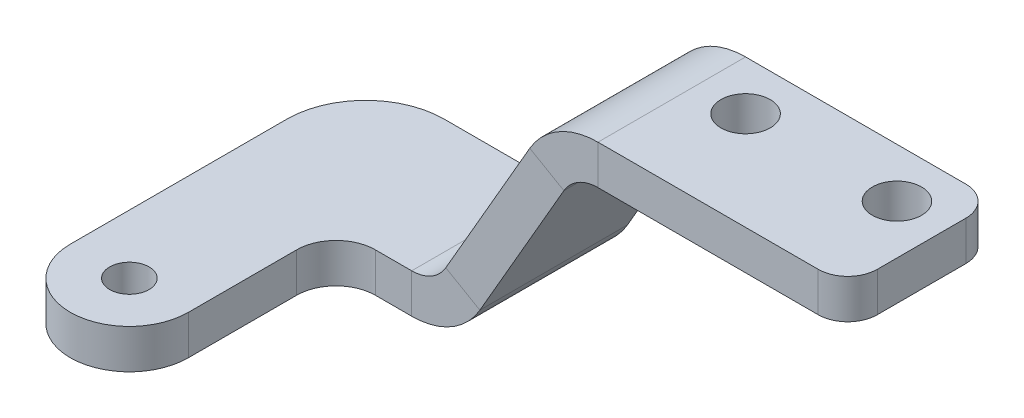
from build123d import *

# Parameters (mm, degrees)
SKETCH_1_R                       = 2
SM_BASE_FLANGE_1_DEPTH           = 4
SM_EDGE_FLANGE_1_STRIP_CUT_DEPTH = 15
SM_EDGE_FLANGE_1_DEPTH           = 15
SM_EDGE_FLANGE_2_STRIP_CUT_DEPTH = 15
SM_EDGE_FLANGE_2_DEPTH           = 15
FILLET_1_R                       = 3
FILLET_2_R                       = 3
CUT_EXTRUDE_1_REACH              = 71.845
SKETCH_14_R                      = 2.5
CUT_EXTRUDE_1_DIRECTION_2_DEPTH  = 70.844662484


# Sheet-metal steps are written as plain solids
with BuildPart() as part:
    # Sketch 1 → Базовая кромка1 (new body)
    with BuildSketch(Plane(origin=(0, 0, 0), x_dir=(1, 0, 0), z_dir=(0, 1, 0))):
        with BuildLine():
            Line((-6, 0), (-6, 22))
            ThreePointArc((-6, 22), (-3.656854249, 27.656854249), (2, 30))
            Line((2, 30), (16, 30))
            Line((16, 30), (16, 15))
            Line((16, 15), (10, 15))
            ThreePointArc((10, 15), (7.171572875, 13.828427125), (6, 11))
            Line((6, 11), (6, 0))
            ThreePointArc((6, 0), (0, -6), (-6, 0))
        make_face()
        with Locations(Location((0, 0, 0), (0, 0, 270))):
            Circle(SKETCH_1_R, mode=Mode.SUBTRACT)
    extrude(amount=-SM_BASE_FLANGE_1_DEPTH)

    # Ребро-кромка1 strip (across the edge) → Ребро-кромка1 strip cut (cut)
    with BuildSketch(Plane(origin=(16, 0, -15), x_dir=(-0.8660254037844366, 0.5000000000000038, 0), z_dir=(0, 0, -1))):
        Polygon((-20.784609691, 7.381197846), (0, -4.618802154), (2, -1.154700538), (-18.784609691, 10.845299462), align=None)
    extrude(amount=SM_EDGE_FLANGE_1_STRIP_CUT_DEPTH, mode=Mode.SUBTRACT)

    # Ребро-кромка1 section (across the edge) → Ребро-кромка1 (add)
    with BuildSketch(Plane(origin=(16, 0, -15), x_dir=(-0.8660254037844366, 0.5000000000000038, 0), z_dir=(0, 0, -1))):
        with BuildLine():
            Line((-4, 2.309401077), (-4, 21.690598923))
            Line((-4, 21.690598923), (0, 21.690598923))
            Line((0, 21.690598923), (0, 2.309401077))
            ThreePointArc((0, 2.309401077), (0.535898385, 0.309401077), (2, -1.154700538))
            Line((2, -1.154700538), (0, -4.618802154))
            ThreePointArc((0, -4.618802154), (-2.92820323, -1.690598923), (-4, 2.309401077))
        make_face()
    extrude(amount=SM_EDGE_FLANGE_1_DEPTH)

    # Ребро-кромка2 strip (across the edge) → Ребро-кромка2 strip cut (cut)
    with BuildSketch(Plane(origin=(30.309401077, 16.784609691, -30), x_dir=(0, -1, 0), z_dir=(0, 0, 1))):
        Polygon((-20.784609691, 7.381197846), (0, -4.618802154), (2, -1.154700538), (-18.784609691, 10.845299462), align=None)
    extrude(amount=SM_EDGE_FLANGE_2_STRIP_CUT_DEPTH, mode=Mode.SUBTRACT)

    # Ребро-кромка2 section (across the edge) → Ребро-кромка2 (add)
    with BuildSketch(Plane(origin=(30.309401077, 16.784609691, -30), x_dir=(0, -1, 0), z_dir=(0, 0, 1))):
        with BuildLine():
            Line((-4, 2.309401077), (-4, 27.690598923))
            Line((-4, 27.690598923), (0, 27.690598923))
            Line((0, 27.690598923), (0, 2.309401077))
            ThreePointArc((0, 2.309401077), (0.535898385, 0.309401077), (2, -1.154700538))
            Line((2, -1.154700538), (0, -4.618802154))
            ThreePointArc((0, -4.618802154), (-2.92820323, -1.690598923), (-4, 2.309401077))
        make_face()
    extrude(amount=SM_EDGE_FLANGE_2_DEPTH)

    # Скругление1
    fillet_1_edges = [part.edges().sort_by_distance(p)[0] for p in [
        (58, 18.784609691, -15),
    ]]
    fillet(fillet_1_edges, radius=FILLET_1_R)

    # Скругление2
    fillet_2_edges = [part.edges().sort_by_distance(p)[0] for p in [
        (58, 18.784609691, -30),
    ]]
    fillet(fillet_2_edges, radius=FILLET_2_R)

    # Эскиз14 → Вырез-Вытянуть1 (cut, up to next)
    with BuildSketch(Plane(origin=(0, 20.784609691, 0), x_dir=(1, 0, 0), z_dir=(0, 1, 0)), mode=Mode.PRIVATE) as cut_extrude_1_sk1:
        with Locations((53, 25)):
            Circle(SKETCH_14_R)
    cut_extrude_1_tool1 = extrude(cut_extrude_1_sk1.sketch, amount=-CUT_EXTRUDE_1_REACH, mode=Mode.PRIVATE) & part.part
    # Эскиз14 → Вырез-Вытянуть1 (cut, up to next)
    with BuildSketch(Plane(origin=(0, 20.784609691, 0), x_dir=(1, 0, 0), z_dir=(0, 1, 0)), mode=Mode.PRIVATE) as cut_extrude_1_sk2:
        with Locations((37.618802154, 25)):
            Circle(SKETCH_14_R)
    cut_extrude_1_tool2 = extrude(cut_extrude_1_sk2.sketch, amount=-CUT_EXTRUDE_1_REACH, mode=Mode.PRIVATE) & part.part
    add(cut_extrude_1_tool1.solids().sort_by_distance((53, 20.78461, -25))[0], mode=Mode.SUBTRACT)
    add(cut_extrude_1_tool2.solids().sort_by_distance((37.618802, 20.78461, -25))[0], mode=Mode.SUBTRACT)

    # Эскиз14 → Вырез-Вытянуть1 direction 2 (cut)
    with BuildSketch(Plane(origin=(0, 20.784609691, 0), x_dir=(1, 0, 0), z_dir=(0, 1, 0))):
        with Locations((53, 25)):
            Circle(SKETCH_14_R)
        with Locations((37.618802154, 25)):
            Circle(SKETCH_14_R)
    extrude(amount=CUT_EXTRUDE_1_DIRECTION_2_DEPTH, mode=Mode.SUBTRACT)


solid = part.part
